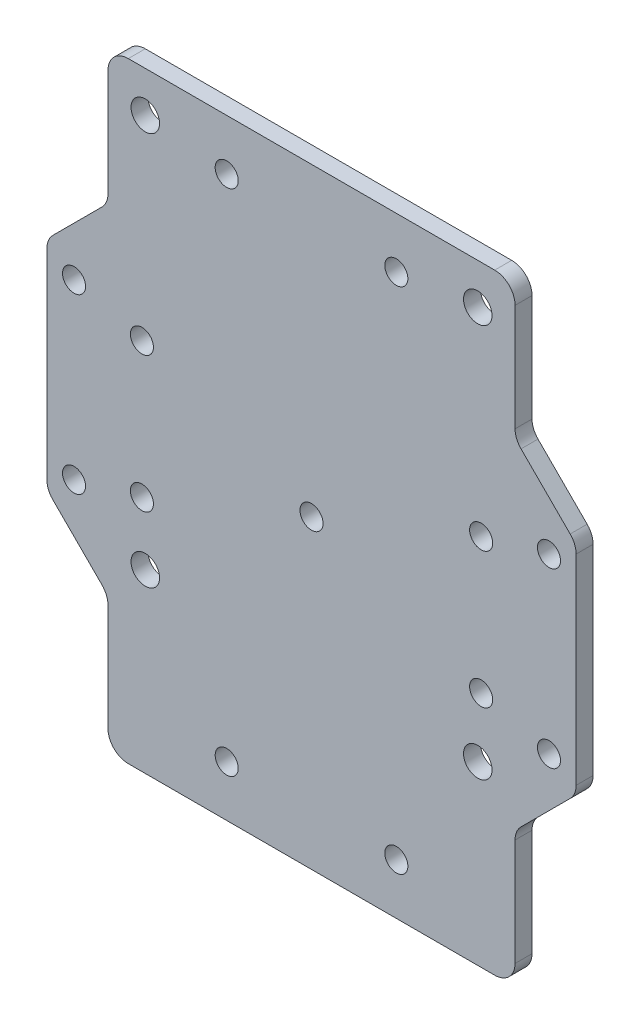
from build123d import *

# Parameters (mm, degrees)
BOSS_EXTRUDE1_DEPTH        = 1.25
FILLET1_R                  = 3
F_4_2_4_2_DIAMETER_HOLE1_D = 4.2
M3_CLEARANCE_HOLE1_D       = 3.4
M3_CLEARANCE_HOLE2_D       = 3.4
M3_CLEARANCE_HOLE3_D       = 3.4


with BuildPart() as part:
    # Sketch1 → Boss-Extrude1 (new, symmetric)
    with BuildSketch(Plane.XY):
        Polygon((-39, 16), (-39, -16), (-30, -25), (-30, -45), (30, -45), (30, -25), (39, -16), (39, 16), (30, 25), (30, 45), (-30, 45), (-30, 25), align=None)
    extrude(amount=BOSS_EXTRUDE1_DEPTH, both=True)

    # Fillet1
    fillet1_edges = [part.edges().sort_by_distance(p)[0] for p in [
        (30, 45, 0),
        (30, -45, 0),
        (-30, -45, 0),
        (-30, 45, 0),
        (30, 25, 0),
        (39, 16, 0),
        (39, -16, 0),
        (30, -25, 0),
        (-30, -25, 0),
        (-39, -16, 0),
        (-39, 16, 0),
        (-30, 25, 0),
    ]]
    fillet(fillet1_edges, radius=FILLET1_R)

    # Ø4.2 (4.2) Diameter Hole1 (through all)
    with Locations(Plane(origin=(0, 0, -1.25), x_dir=(-1, 0, 0), z_dir=(0, 0, -1))):
        with Locations((-24.5, -19), (24.5, -19), (24.5, 39), (-24.5, 39)):
            Hole(F_4_2_4_2_DIAMETER_HOLE1_D / 2)

    # M3 Clearance Hole1 (through all)
    with Locations(Plane(origin=(0, 0, -1.25), x_dir=(-1, 0, 0), z_dir=(0, 0, -1))):
        with Locations((-35, 12.75), (-35, -12.75), (35, -12.75), (35, 12.75)):
            Hole(M3_CLEARANCE_HOLE1_D / 2)

    # M3 Clearance Hole2 (through all)
    with Locations(Plane.XY.offset(1.25)):
        with Locations((-12.5, -37.5), (12.5, -37.5), (-12.5, 37.5), (12.5, 37.5), (-25, 10), (-25, -10), (25, -10), (25, 10)):
            Hole(M3_CLEARANCE_HOLE2_D / 2)

    # M3 Clearance Hole3 (through all)
    with Locations(Plane.XY.offset(1.25)):
        with Locations((0, 0)):
            Hole(M3_CLEARANCE_HOLE3_D / 2)


solid = part.part
